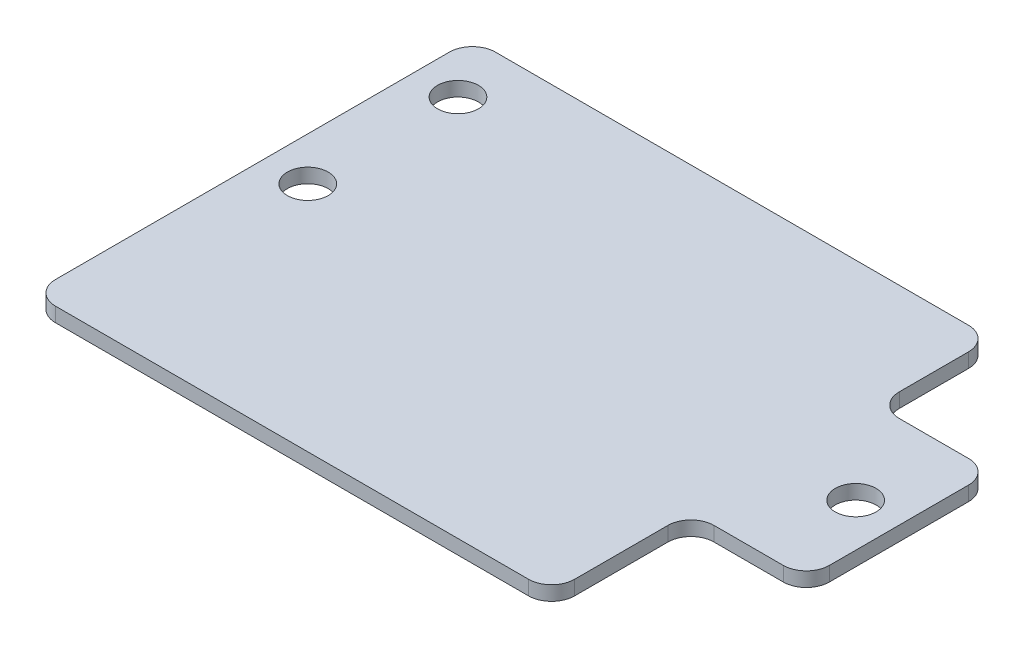
from build123d import *

# Parameters (mm, degrees)
BOSS_EXTRUDE1_DEPTH = 1.5875
FILLET1_R           = 2.54
SKETCH2_R           = 2.2479
CUT_EXTRUDE1_DEPTH  = 86.013096347


with BuildPart() as part:
    # Sketch1 → Boss-Extrude1 (new body)
    with BuildSketch(Plane(origin=(0, 0, 0), x_dir=(1, 0, 0), z_dir=(0, 1, 0))):
        Polygon((0, 0), (0, -48.432260883), (57.15, -48.432260883), (57.15, -33.090501198), (69.85, -33.090501198), (69.85, -12.7), (57.15, -12.7), (57.15, 0), align=None)
    extrude(amount=BOSS_EXTRUDE1_DEPTH)

    # Fillet1
    fillet1_edges = [part.edges().sort_by_distance(p)[0] for p in [
        (0, 0.79375, 48.432260883),
        (0, 0.79375, 0),
        (57.15, 0.79375, 0),
        (57.15, 0.79375, 48.432260883),
        (69.85, 0.79375, 33.090501198),
        (69.85, 0.79375, 12.7),
        (57.15, 0.79375, 33.090501198),
        (57.15, 0.79375, 12.7),
    ]]
    fillet(fillet1_edges, radius=FILLET1_R)

    # Sketch2 → Cut-Extrude1 (cut, through all)
    with BuildSketch(Plane(origin=(0, 1.5875, 0), x_dir=(1, 0, 0), z_dir=(0, 1, 0))):
        with Locations((4.7625, -6.35)):
            Circle(SKETCH2_R)
        with Locations((4.7625, -22.8854)):
            Circle(SKETCH2_R)
        with Locations((65.0748, -22.8854)):
            Circle(SKETCH2_R)
    extrude(amount=-CUT_EXTRUDE1_DEPTH, mode=Mode.SUBTRACT)


solid = part.part
